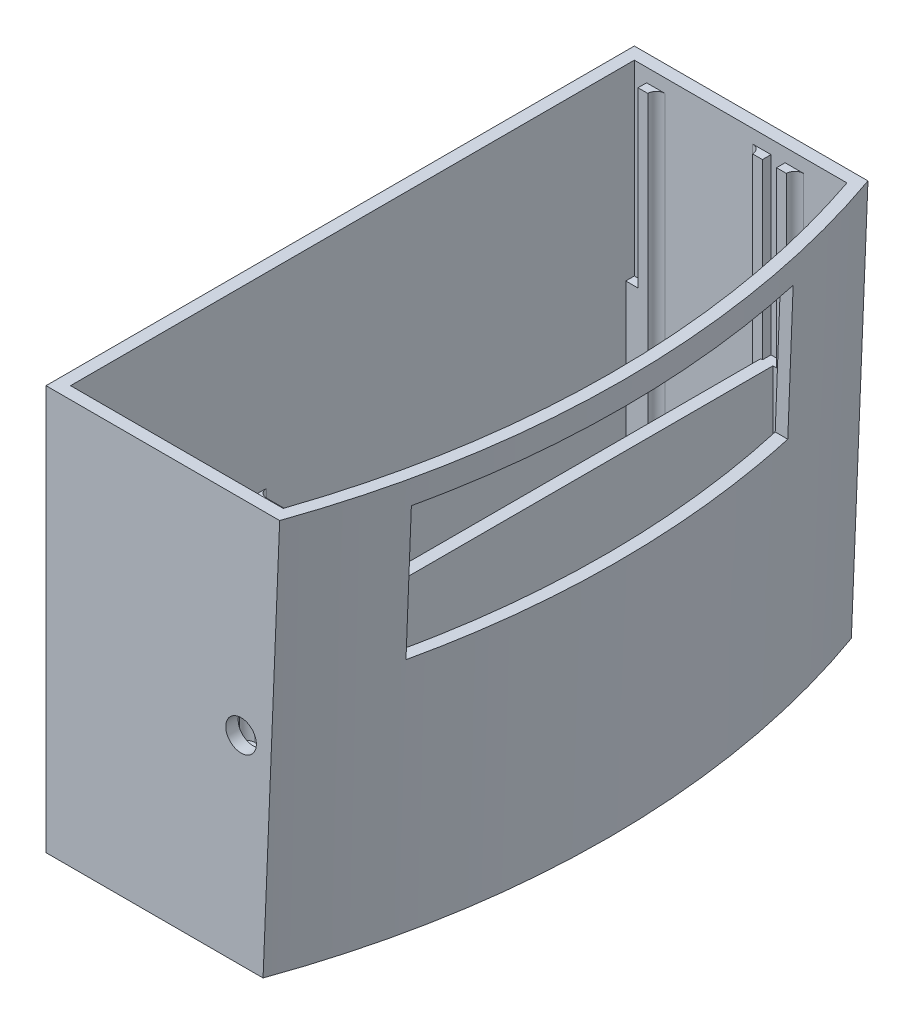
from build123d import *

# Parameters (mm, degrees)
SHELL1_T               = -2
BOSS_EXTRUDE1_START    = 2
SKETCH7_6_W            = 6
SKETCH7_6_H            = 2
BOSS_EXTRUDE1_DEPTH    = 33.5
SKETCH7_9_W            = 2
SKETCH7_9_H            = 1.4
SKETCH7_9_W_2          = 2.3
SKETCH7_9_W_3          = 0.6
BOSS_EXTRUDE3_DEPTH    = 35.5
SKETCH7_8_W            = 1.6
SKETCH7_8_H            = 1.4
SKETCH7_8_W_2          = 1.3
SKETCH7_8_W_3          = 0.3
BOSS_EXTRUDE2_DEPTH    = 63.8
FILLET1_R              = 1.4
CUT_EXTRUDE1_START     = -46.163243618
CUT_EXTRUDE1_OUTLINE_W = 62.3
CUT_EXTRUDE1_OUTLINE_H = 22.2
CUT_EXTRUDE1_DEPTH     = 6.326424063
CUT_EXTRUDE2_START     = -2
SKETCH11_R             = 2.5
CUT_EXTRUDE2_DEPTH     = 96


# Read off the part's stored shape, not the designer's step: Cut-Extrude1
with BuildPart() as part:
    # Sketch7 → Loft1 section 0
    with BuildSketch(Plane(origin=(0, 0, 0), x_dir=(1, 0, 0), z_dir=(0, 1, 0))):
        with BuildLine():
            Line((0, 96), (35.41423357, 96))
            ThreePointArc((35.41423357, 96), (43.772922591, 48), (35.41423357, 0))
            Line((35.41423357, 0), (0, 0))
            Line((0, 0), (0, 96))
        make_face()
    # Sketch9 → Loft1 section 1
    with BuildSketch(Plane(origin=(0, 66, 0), x_dir=(1, 0, 0), z_dir=(0, 1, 0))):
        with BuildLine():
            Line((0, 96), (38.124209432, 96))
            ThreePointArc((38.124209432, 96), (46.317469671, 48), (38.124209432, 0))
            Line((38.124209432, 0), (0, 0))
            Line((0, 0), (0, 96))
        make_face()
    loft()

    # Shell1
    shell1_openings = [part.faces().sort_by_distance(p)[0] for p in [
        (21.876860879, 66, -48),
    ]]
    offset(amount=SHELL1_T, openings=shell1_openings, kind=Kind.INTERSECTION)

    # Sketch7<6> → Boss-Extrude1 (add)
    with BuildSketch(Plane(origin=(0, 0, 0), x_dir=(1, 0, 0), z_dir=(0, 1, 0)).offset(BOSS_EXTRUDE1_START)):
        with Locations((5, 31.6)):
            Rectangle(SKETCH7_6_W, SKETCH7_6_H)
        Polygon((18, 32.6), (18, 30.6), (26, 30.6), (26, 94), (24, 94), (24, 32.6), align=None)
    extrude(amount=BOSS_EXTRUDE1_DEPTH)

    # Sketch7<9> → Boss-Extrude3 (add)
    with BuildSketch(Plane(origin=(0, 0, 0), x_dir=(1, 0, 0), z_dir=(0, 1, 0))):
        with Locations((3, 2.7)):
            Rectangle(SKETCH7_9_W, SKETCH7_9_H)
        with Locations((25.45, 2.7)):
            Rectangle(SKETCH7_9_W_2, SKETCH7_9_H)
        with Locations((3, 93.3)):
            Rectangle(SKETCH7_9_W, SKETCH7_9_H)
        with Locations((26.3, 93.3)):
            Rectangle(SKETCH7_9_W_3, SKETCH7_9_H)
    extrude(amount=BOSS_EXTRUDE3_DEPTH)

    # Sketch7<8> → Boss-Extrude2 (add)
    with BuildSketch(Plane(origin=(0, 0, 0), x_dir=(1, 0, 0), z_dir=(0, 1, 0))):
        with Locations((4.8, 2.7)):
            Rectangle(SKETCH7_8_W, SKETCH7_8_H)
        with Locations((27.4, 2.7)):
            Rectangle(SKETCH7_8_W, SKETCH7_8_H)
        with Locations((23.5, 2.7)):
            Rectangle(SKETCH7_8_W, SKETCH7_8_H)
        with Locations((4.8, 93.3)):
            Rectangle(SKETCH7_8_W, SKETCH7_8_H)
        with Locations((27.4, 93.3)):
            Rectangle(SKETCH7_8_W, SKETCH7_8_H)
        with Locations((23.35, 93.3)):
            Rectangle(SKETCH7_8_W_2, SKETCH7_8_H)
        with Locations((24.15, 93.3)):
            Rectangle(SKETCH7_8_W_3, SKETCH7_8_H)
    extrude(amount=BOSS_EXTRUDE2_DEPTH)

    # Fillet1
    fillet1_edges = [part.edges().sort_by_distance(p)[0] for p in [
        (22.7, 32.9, -94),
        (28.2, 32.9, -94),
        (5.6, 32.9, -94),
        (2, 18.75, -32.6),
        (2, 18.75, -30.6),
        (5.6, 32.9, -2),
        (22.7, 32.9, -2),
        (28.2, 32.9, -2),
    ]]
    fillet(fillet1_edges, radius=FILLET1_R - 0.0001)  # a hair under: the kernel refuses the full size

    # Cut-Extrude1 outline → Cut-Extrude1 (cut)
    with BuildSketch(Plane.ZY.offset(CUT_EXTRUDE1_START)):
        with Locations((-48, 50.9)):
            Rectangle(CUT_EXTRUDE1_OUTLINE_W, CUT_EXTRUDE1_OUTLINE_H)
    extrude(amount=CUT_EXTRUDE1_DEPTH, mode=Mode.SUBTRACT)

    # Sketch11 → Cut-Extrude2 (cut)
    with BuildSketch(Plane.XY.offset(-94).offset(CUT_EXTRUDE2_START)):
        with Locations(Location((31.825322124, 32.5, 0), (0, 0, 180))):
            Circle(SKETCH11_R)
    extrude(amount=CUT_EXTRUDE2_DEPTH, mode=Mode.SUBTRACT)


solid = part.part
